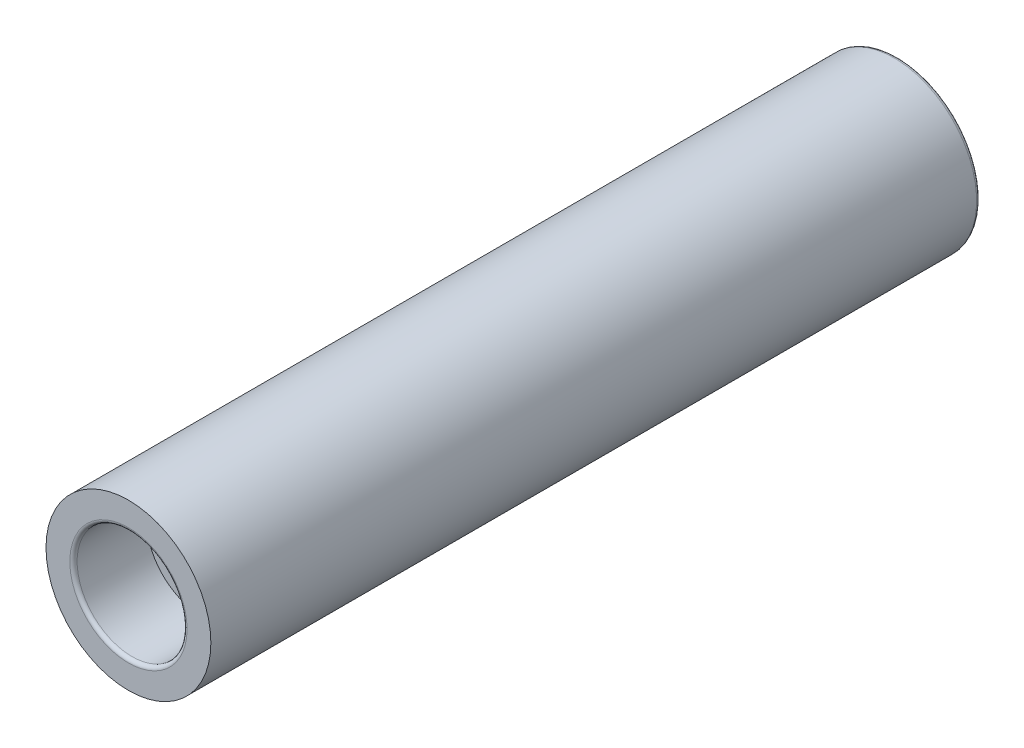
from build123d import *

# Parameters (mm, degrees)
SKETCH1_R           = 4.5
SKETCH1_R_2         = 1
EXTRUDE_THIN1_DEPTH = 12
SKETCH11_R          = 4.5
SKETCH11_R_2        = 1.5
EXTRUDE_THIN3_DEPTH = 5
SKETCH12_R          = 4.5
SKETCH12_R_2        = 3
EXTRUDE_THIN4_DEPTH = 4
THREAD1_PITCH       = 0.5
FILLET1_R           = 0.2


with BuildPart() as part:
    # Sketch1 → Extrude-Thin1 (new body)
    with BuildSketch(Plane.XY):
        Circle(SKETCH1_R)
        Circle(SKETCH1_R_2, mode=Mode.SUBTRACT)
    extrude_thin1 = extrude(amount=EXTRUDE_THIN1_DEPTH)

    # Sketch11 → Extrude-Thin3 (add)
    with BuildSketch(Plane.XY.offset(12)):
        Circle(SKETCH11_R)
        Circle(SKETCH11_R_2, mode=Mode.SUBTRACT)
    extrude_thin3 = extrude(amount=EXTRUDE_THIN3_DEPTH)

    # Sketch12 → Extrude-Thin4 (add)
    with BuildSketch(Plane.XY.offset(17)):
        Circle(SKETCH12_R)
        Circle(SKETCH12_R_2, mode=Mode.SUBTRACT)
    extrude_thin4 = extrude(amount=EXTRUDE_THIN4_DEPTH)

    # Thread1: the profile of Thread Profile1 profile screwed along a right-hand helix of 10 turns, 6 arcs to a turn; built about Z, then put on its axis
    thread1_z = Axis((0, 0, 0), (0, 0, 1))
    thread1_corners = [(1.5003, 0, -0.000173205), (1.5003, 0, 0.437673204), (1.229367063, 0, 0.281249999), (1.229367063, 0, 0.156249999)]
    with BuildLine(mode=Mode.PRIVATE) as thread1_profile:
        Line(thread1_corners[0], thread1_corners[1])
        Line(thread1_corners[1], thread1_corners[2])
        Line(thread1_corners[2], thread1_corners[3])
        Line(thread1_corners[3], thread1_corners[0])
    thread1_cap = Face(thread1_profile.wire())
    thread1_turn_angles = [0, 30, 60, 90, 120, 150, 180, 210, 240, 270, 300, 330, 360]
    thread1_turn_weights = [1, 0.8660254037844387, 1, 0.8660254037844387, 1, 0.8660254037844387, 1, 0.8660254037844387, 1, 0.8660254037844387, 1, 0.8660254037844387, 1]
    thread1_turn_rails = [Edge.make_bspline([Vector(p[0], p[1], 0).rotate(thread1_z, thread1_turn_angles[k]) / thread1_turn_weights[k] + Vector(0, 0, p[2] + THREAD1_PITCH * thread1_turn_angles[k] / 360) for k in range(13)], [0, 0, 0, 1, 1, 2, 2, 3, 3, 4, 4, 5, 5, 6, 6, 6], 2, thread1_turn_weights) for p in thread1_corners]
    thread1_turn_sides = [Face.make_surface_from_curves(thread1_turn_rails[p[0]], thread1_turn_rails[p[1]]) for p in [(0, 1), (1, 2), (2, 3), (3, 0)]]
    thread1 = Plane(origin=(0, 0, 12), x_dir=(1, 0, 0), z_dir=(0, 0, 1)) * Solid(Shell([*[p.moved(Location((0, 0, THREAD1_PITCH * i))) for i in range(10) for p in thread1_turn_sides], thread1_cap, thread1_cap.rotate(thread1_z, 3600).moved(Location((0, 0, THREAD1_PITCH * 3600 / 360)))]))
    add(thread1)

    # Mirror2: Extrude-Thin1, Extrude-Thin3, Extrude-Thin4, Thread1 across plane
    add(extrude_thin1.mirror(Plane.XY))
    add(extrude_thin3.mirror(Plane.XY))
    add(extrude_thin4.mirror(Plane.XY))
    add(thread1.mirror(Plane.XY))

    # Fillet1
    fillet1_edges = [part.edges().sort_by_distance(p)[0] for p in [
        (-3, 0, 21),
        (-4.5, 0, -21),
        (-3, 0, -21),
    ]]
    fillet(fillet1_edges, radius=FILLET1_R)


solid = part.part
